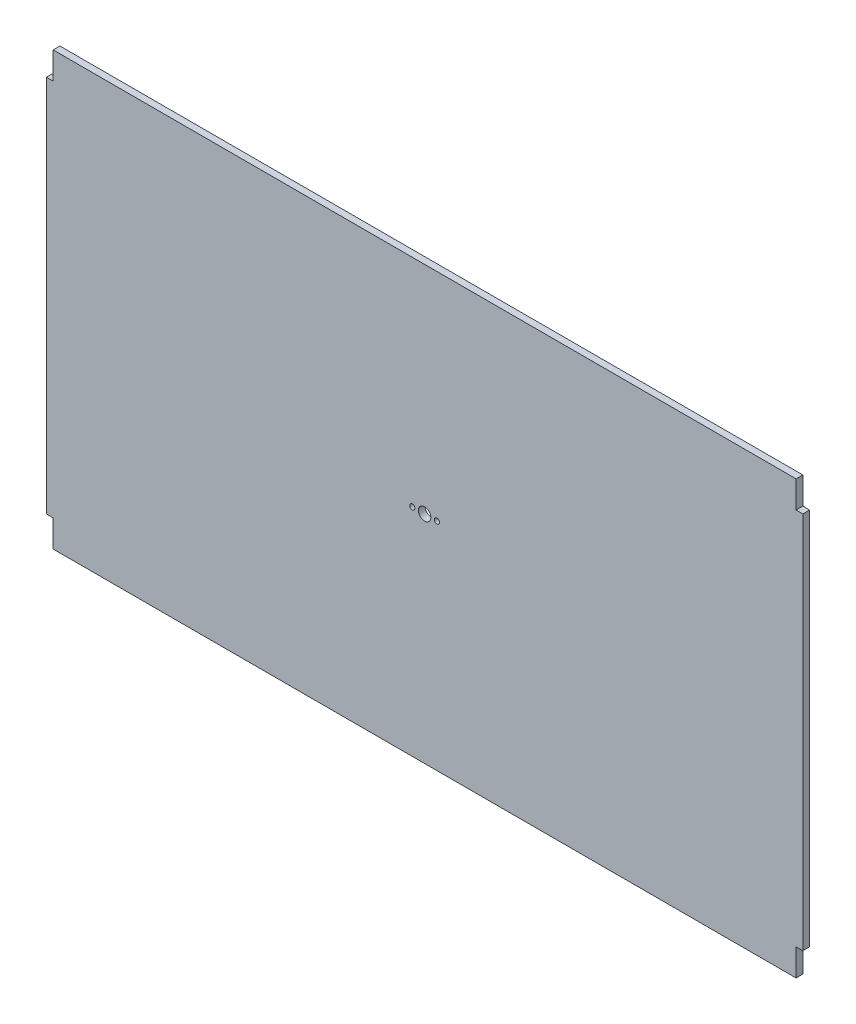
from build123d import *

# Parameters (mm, degrees)
BOSS_EXTRUDE1_DEPTH = 3.175
SKETCH2_R           = 2.921
SKETCH2_R_2         = 1.2065
CUT_EXTRUDE1_DEPTH  = 410.575


with BuildPart() as part:
    # Sketch1 → Boss-Extrude1 (new body)
    with BuildSketch(Plane.XY):
        Polygon((3.175, 203.2), (3.175, 190.5), (0, 190.5), (0, 12.7), (3.175, 12.7), (3.175, 0), (352.425, 0), (352.425, 12.7), (355.6, 12.7), (355.6, 190.5), (352.425, 190.5), (352.425, 203.2), align=None)
    extrude(amount=BOSS_EXTRUDE1_DEPTH)

    # Sketch2 → Cut-Extrude1 (cut, through all)
    with BuildSketch(Plane.XY.offset(3.175)):
        with Locations((177.8, 101.6)):
            Circle(SKETCH2_R)
        with Locations((183.5785, 101.6)):
            Circle(SKETCH2_R_2)
        with Locations((172.0215, 101.6)):
            Circle(SKETCH2_R_2)
    extrude(amount=-CUT_EXTRUDE1_DEPTH, mode=Mode.SUBTRACT)


solid = part.part
